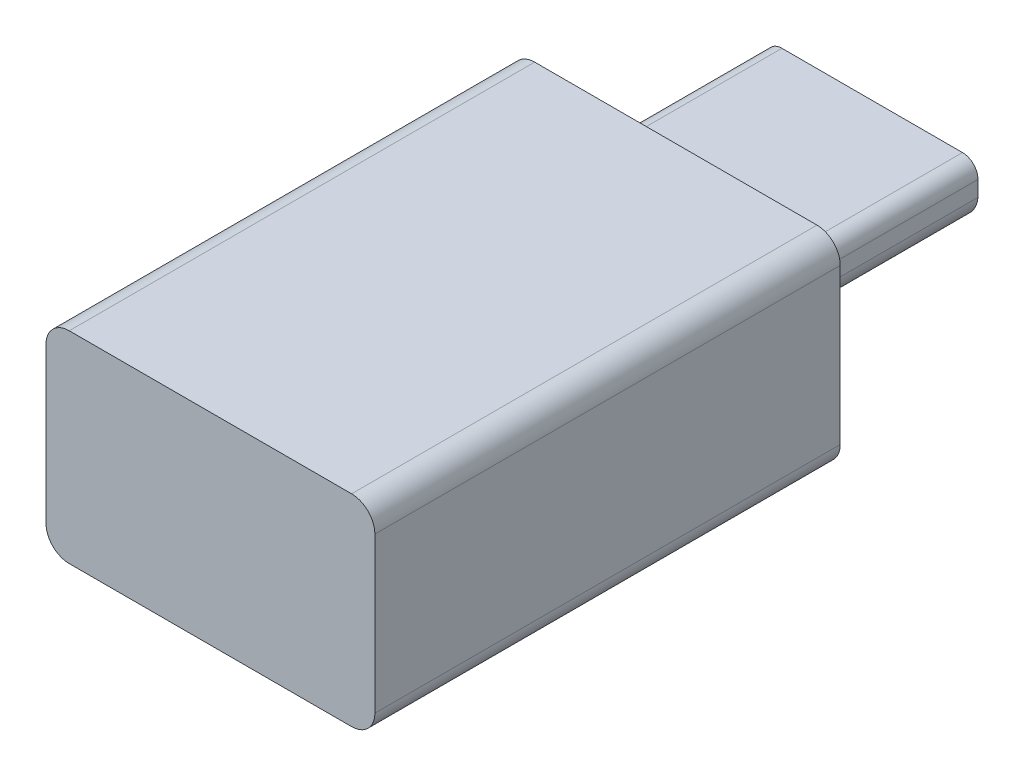
from build123d import *

# Parameters (mm, degrees)
BOSS_EXTRUDE1_DEPTH = 15
BOSS_EXTRUDE2_DEPTH = 6.33


with BuildPart() as part:
    # Sketch1 → Boss-Extrude1 (new body)
    with BuildSketch(Plane(origin=(0, 0, 87.601912264), x_dir=(-1, 0, 0), z_dir=(0, 0, -1))):
        with BuildLine():
            Line((38.270660543, 36.840565439), (47.370660543, 36.840565439))
            ThreePointArc((47.370660543, 36.840565439), (47.900990629, 36.620895525), (48.120660543, 36.090565439))
            Line((48.120660543, 36.090565439), (48.120660543, 31.090565439))
            ThreePointArc((48.120660543, 31.090565439), (47.900990629, 30.560235353), (47.370660543, 30.340565439))
            Line((47.370660543, 30.340565439), (38.270660543, 30.340565439))
            ThreePointArc((38.270660543, 30.340565439), (37.740330458, 30.560235353), (37.520660543, 31.090565439))
            Line((37.520660543, 31.090565439), (37.520660543, 36.090565439))
            ThreePointArc((37.520660543, 36.090565439), (37.740330458, 36.620895525), (38.270660543, 36.840565439))
        make_face()
    extrude(amount=BOSS_EXTRUDE1_DEPTH)

    # Sketch2 → Boss-Extrude2 (add)
    with BuildSketch(Plane(origin=(0, 0, 72.601912264), x_dir=(-1, 0, 0), z_dir=(0, 0, -1))):
        with BuildLine():
            ThreePointArc((39.410660543, 33.880565439), (39.704827774, 33.289230716), (40.320660543, 33.050565439))
            Line((40.320660543, 33.050565439), (45.320660543, 33.050565439))
            ThreePointArc((45.320660543, 33.050565439), (45.936493313, 33.289230716), (46.230660543, 33.880565439))
            Line((46.230660543, 33.880565439), (46.230660543, 34.380565439))
            ThreePointArc((46.230660543, 34.380565439), (46.084213934, 34.73411883), (45.730660543, 34.880565439))
            Line((45.730660543, 34.880565439), (39.910660543, 34.880565439))
            ThreePointArc((39.910660543, 34.880565439), (39.557107153, 34.73411883), (39.410660543, 34.380565439))
            Line((39.410660543, 34.380565439), (39.410660543, 33.880565439))
        make_face()
    extrude(amount=BOSS_EXTRUDE2_DEPTH)


solid = part.part
